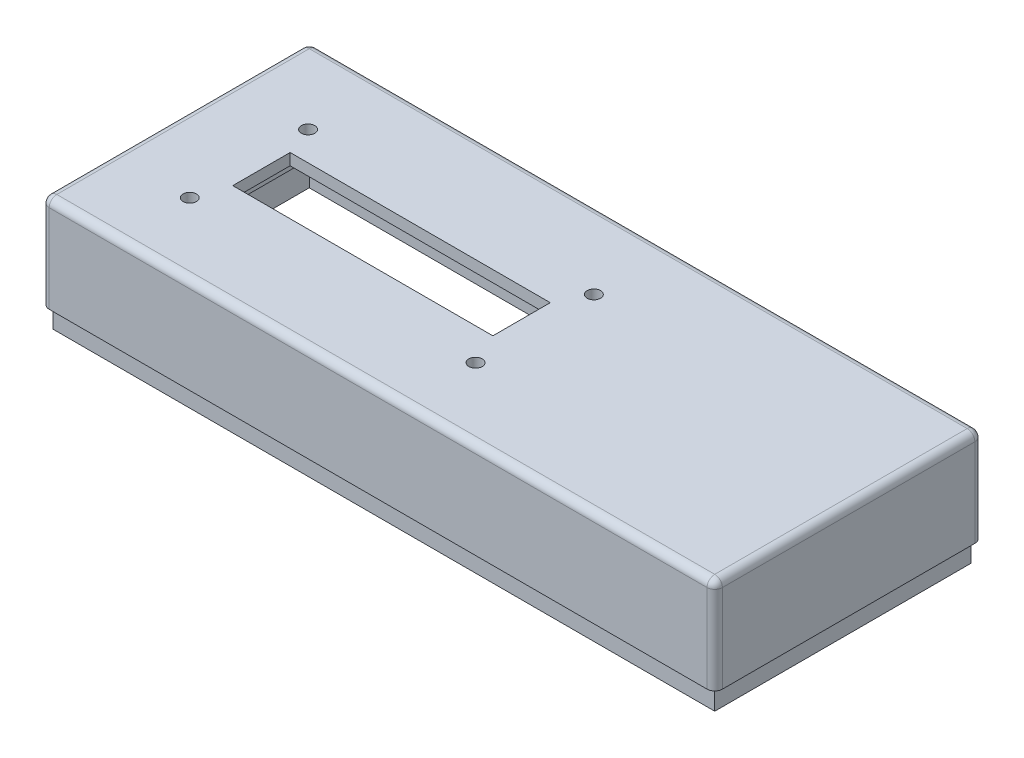
from build123d import *

# Parameters (mm, degrees)
SKETCH1_W           = 176
SKETCH1_H           = 70
BOSS_EXTRUDE1_DEPTH = 30.5
SKETCH2_W           = 170
SKETCH2_H           = 64
CUT_EXTRUDE1_DEPTH  = 27.5
SKETCH3_W           = 176
SKETCH3_H           = 70
SKETCH3_W_2         = 173
SKETCH3_H_2         = 67
CUT_EXTRUDE2_DEPTH  = 5.5
FILLET1_R           = 2
SKETCH4_W           = 78
SKETCH4_H           = 31
SKETCH4_W_2         = 72
SKETCH4_H_2         = 25
BOSS_EXTRUDE2_DEPTH = 3
CUT_EXTRUDE3_REACH  = 100.617
SKETCH5_W           = 68
SKETCH5_H           = 15
CUT_EXTRUDE4_REACH  = 101.495
SKETCH6_R           = 1.75


with BuildPart() as part:
    # Sketch1 → Boss-Extrude1 (new body)
    with BuildSketch(Plane(origin=(0, 0, 0), x_dir=(1, 0, 0), z_dir=(0, 1, 0))):
        Rectangle(SKETCH1_W, SKETCH1_H)
    extrude(amount=BOSS_EXTRUDE1_DEPTH)

    # Sketch2 → Cut-Extrude1 (cut)
    with BuildSketch(Plane.XZ):
        Rectangle(SKETCH2_W, SKETCH2_H)
    extrude(amount=-CUT_EXTRUDE1_DEPTH, mode=Mode.SUBTRACT)

    # Sketch3 → Cut-Extrude2 (cut)
    with BuildSketch(Plane.XZ):
        Rectangle(SKETCH3_W, SKETCH3_H)
        Rectangle(SKETCH3_W_2, SKETCH3_H_2, mode=Mode.SUBTRACT)
    extrude(amount=-CUT_EXTRUDE2_DEPTH, mode=Mode.SUBTRACT)

    # Fillet1
    fillet1_edges = [part.edges().sort_by_distance(p)[0] for p in [
        (-88, 30.5, 0),
        (0, 30.5, -35),
        (88, 30.5, 0),
        (0, 30.5, 35),
        (88, 18, 35),
        (88, 18, -35),
        (-88, 18, -35),
        (-88, 18, 35),
    ]]
    fillet(fillet1_edges, radius=FILLET1_R)

    # Sketch4 → Boss-Extrude2 (add)
    with BuildSketch(Plane.XZ.offset(-27.5)):
        with Locations((-31, 0.5)):
            Rectangle(SKETCH4_W, SKETCH4_H)
        with Locations((-31, 0.5)):
            Rectangle(SKETCH4_W_2, SKETCH4_H_2, mode=Mode.SUBTRACT)
    extrude(amount=BOSS_EXTRUDE2_DEPTH)

    # Sketch5 → Cut-Extrude3 (cut, up to next)
    with BuildSketch(Plane.XZ.offset(-27.5), mode=Mode.PRIVATE) as cut_extrude3_sk1:
        with Locations((-31, 0.5)):
            Rectangle(SKETCH5_W, SKETCH5_H)
    cut_extrude3_tool1 = extrude(cut_extrude3_sk1.sketch, amount=-CUT_EXTRUDE3_REACH, mode=Mode.PRIVATE) & part.part
    add(cut_extrude3_tool1.solids().sort_by_distance((-31, 27.5, 0.5))[0], mode=Mode.SUBTRACT)

    # Sketch6 → Cut-Extrude4 (cut, up to next)
    with BuildSketch(Plane(origin=(0, 30.5, 0), x_dir=(1, 0, 0), z_dir=(0, 1, 0)), mode=Mode.PRIVATE) as cut_extrude4_sk1:
        with Locations((-67.88, 14.57)):
            Circle(SKETCH6_R)
    cut_extrude4_tool1 = extrude(cut_extrude4_sk1.sketch, amount=-CUT_EXTRUDE4_REACH, mode=Mode.PRIVATE) & part.part
    # Sketch6 → Cut-Extrude4 (cut, up to next)
    with BuildSketch(Plane(origin=(0, 30.5, 0), x_dir=(1, 0, 0), z_dir=(0, 1, 0)), mode=Mode.PRIVATE) as cut_extrude4_sk2:
        with Locations((6.83, 14.57)):
            Circle(SKETCH6_R)
    cut_extrude4_tool2 = extrude(cut_extrude4_sk2.sketch, amount=-CUT_EXTRUDE4_REACH, mode=Mode.PRIVATE) & part.part
    # Sketch6 → Cut-Extrude4 (cut, up to next)
    with BuildSketch(Plane(origin=(0, 30.5, 0), x_dir=(1, 0, 0), z_dir=(0, 1, 0)), mode=Mode.PRIVATE) as cut_extrude4_sk3:
        with Locations((6.83, -16.36)):
            Circle(SKETCH6_R)
    cut_extrude4_tool3 = extrude(cut_extrude4_sk3.sketch, amount=-CUT_EXTRUDE4_REACH, mode=Mode.PRIVATE) & part.part
    # Sketch6 → Cut-Extrude4 (cut, up to next)
    with BuildSketch(Plane(origin=(0, 30.5, 0), x_dir=(1, 0, 0), z_dir=(0, 1, 0)), mode=Mode.PRIVATE) as cut_extrude4_sk4:
        with Locations((-67.88, -16.36)):
            Circle(SKETCH6_R)
    cut_extrude4_tool4 = extrude(cut_extrude4_sk4.sketch, amount=-CUT_EXTRUDE4_REACH, mode=Mode.PRIVATE) & part.part
    add(cut_extrude4_tool1.solids().sort_by_distance((-67.88, 30.5, -14.57))[0], mode=Mode.SUBTRACT)
    add(cut_extrude4_tool2.solids().sort_by_distance((6.83, 30.5, -14.57))[0], mode=Mode.SUBTRACT)
    add(cut_extrude4_tool3.solids().sort_by_distance((6.83, 30.5, 16.36))[0], mode=Mode.SUBTRACT)
    add(cut_extrude4_tool4.solids().sort_by_distance((-67.88, 30.5, 16.36))[0], mode=Mode.SUBTRACT)


solid = part.part
